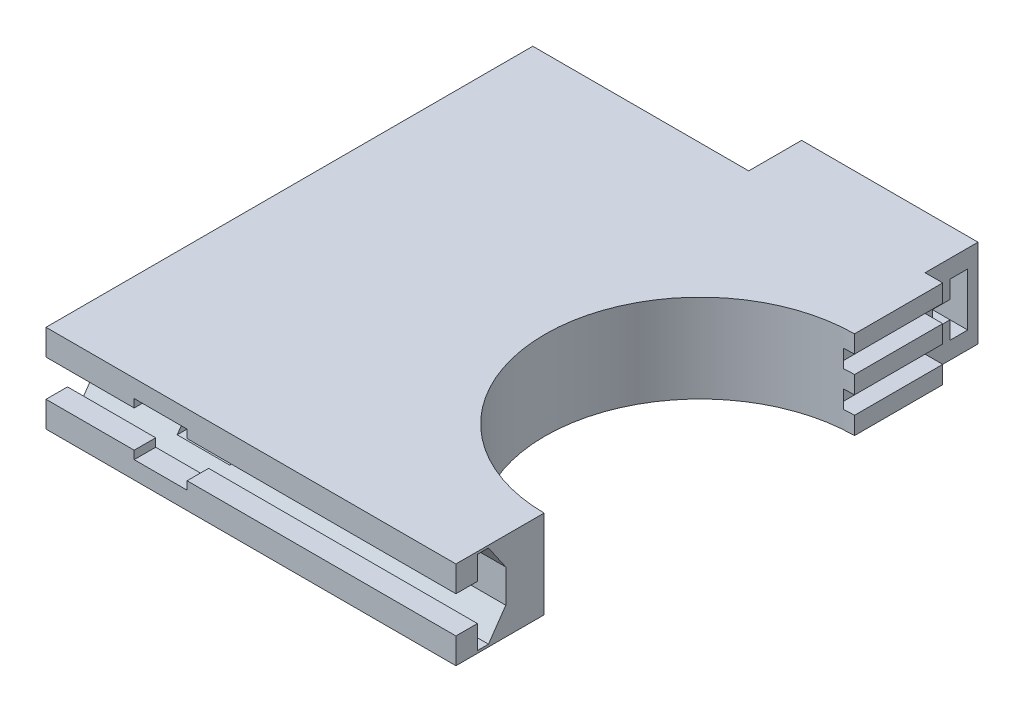
from build123d import *

# Parameters (mm, degrees)
SKETCH1_R               = 35.052
SKETCH1_R_2             = 22.352
BOSS_EXTRUDE2_DEPTH     = 12.7
CUT_EXTRUDE4_DEPTH      = 52.172017822
CUT_EXTRUDE4_DEPTH_BACK = 52.172017822
SKETCH4_W               = 50.006101534
SKETCH4_H               = 77.834708864
BOSS_EXTRUDE6_START     = -12.7
BOSS_EXTRUDE6_DEPTH     = 12.7
CUT_EXTRUDE5_DEPTH      = 93.599518977
CUT_EXTRUDE5_DEPTH_BACK = 93.599518977
SKETCH14_W              = 7.62
SKETCH14_H              = 7.62
CAVITY1_START           = 2.54
CAVITY1_DEPTH           = 2.54
CAVITY1_START_2         = 7.62
CAVITY1_2_DEPTH         = 2.54
SKETCH16_W              = 25.4
SKETCH16_H              = 12.7
BOSS_EXTRUDE8_DEPTH     = 7.62
CAVITY3_START           = -41.188715615
CAVITY3_OUTLINE_W       = 25.4
CAVITY3_OUTLINE_H       = 7.62
CAVITY3_DEPTH           = 2.54
CAVITY3_START_2         = -38.648715615
CAVITY3_2_OUTLINE_W     = 25.4
CAVITY3_2_OUTLINE_H     = 2.54
CAVITY3_2_DEPTH         = 2.54
CUT_EXTRUDE6_DEPTH      = 74.941076403
CUT_EXTRUDE6_DEPTH_BACK = 74.941076403


# Read off the part's stored shape, not the designer's step: Cavity1, Cavity3
with BuildPart() as part:
    # Sketch1 → Boss-Extrude2 (new body)
    with BuildSketch(Plane(origin=(0, 0, 0), x_dir=(1, 0, 0), z_dir=(0, 1, 0))):
        with Locations(Location((0, 0, 0), (0, 0, 270))):
            Circle(SKETCH1_R)
        with Locations(Location((0, 0, 0), (0, 0, 270))):
            Circle(SKETCH1_R_2, mode=Mode.SUBTRACT)
    extrude(amount=BOSS_EXTRUDE2_DEPTH)

    # Sketch4 → Cut-Extrude4 (cut, two sides: drawn at the far end of the back side and taken through both)
    with BuildSketch(Plane(origin=(0, 12.7, 0), x_dir=(1, 0, 0), z_dir=(0, 1, 0)).offset(-CUT_EXTRUDE4_DEPTH_BACK)):
        with Locations((24.88666989, 1.453038664)):
            Rectangle(SKETCH4_W, SKETCH4_H)
    extrude(amount=CUT_EXTRUDE4_DEPTH + CUT_EXTRUDE4_DEPTH_BACK, mode=Mode.SUBTRACT)

    # Sketch13 → Boss-Extrude6 (add)
    with BuildSketch(Plane(origin=(0, 12.7, 0), x_dir=(1, 0, 0), z_dir=(0, 1, 0)).offset(BOSS_EXTRUDE6_START)):
        with BuildLine():
            Line((-22.534267524, 26.848640397), (-22.534267524, 35.051806794))
            Line((-22.534267524, 35.051806794), (-59.151198439, 35.051806794))
            Line((-59.151198439, 35.051806794), (-59.151198439, -35.051806794))
            Line((-59.151198439, -35.051806794), (-22.534267524, -35.051806794))
            Line((-22.534267524, -35.051806794), (-22.534267524, -26.848640397))
            ThreePointArc((-22.534267524, -26.848640397), (-35.052, 0), (-22.534267524, 26.848640397))
        make_face()
        with BuildLine():
            ThreePointArc((-22.534267524, 26.848640397), (-12.045163053, 32.917423214), (-0.116380877, 35.051806794))
            Line((-0.116380877, 35.051806794), (-22.534267524, 35.051806794))
            Line((-22.534267524, 35.051806794), (-22.534267524, 26.848640397))
        make_face()
        with BuildLine():
            Line((-22.534267524, -35.051806794), (-0.116380877, -35.051806794))
            ThreePointArc((-0.116380877, -35.051806794), (-12.045163053, -32.917423214), (-22.534267524, -26.848640397))
            Line((-22.534267524, -26.848640397), (-22.534267524, -35.051806794))
        make_face()
    extrude(amount=BOSS_EXTRUDE6_DEPTH)

    # Sketch14 → Cut-Extrude5 (cut, two sides: drawn at the far end of the back side and taken through both)
    with BuildSketch(Plane.XY.offset(35.051806794).offset(-CUT_EXTRUDE5_DEPTH_BACK)):
        with Locations((-42.641198439, 6.35)):
            Rectangle(SKETCH14_W, SKETCH14_H)
    extrude(amount=CUT_EXTRUDE5_DEPTH + CUT_EXTRUDE5_DEPTH_BACK, mode=Mode.SUBTRACT)

    # Cavity1 outline → Cavity1 (cut)
    with BuildSketch(Plane(origin=(0, 0, 0), x_dir=(1, 0, 0), z_dir=(0, 1, 0)).offset(CAVITY1_START)):
        with BuildLine():
            Line((-2.656380877, 35.051806794), (-2.656380877, 22.289859607))
            Line((-2.656380877, 22.289859607), (-1.66555177, 22.289859607))
            ThreePointArc((-1.66555177, 22.289859607), (-0.891502639, 22.33421427), (-0.116380877, 22.351697016))
            Line((-0.116380877, 22.351697016), (-0.116380877, 35.051806794))
            Line((-0.116380877, 35.051806794), (-2.656380877, 35.051806794))
        make_face()
    extrude(amount=CAVITY1_DEPTH, mode=Mode.SUBTRACT)

    # Cavity1 2 outline → Cavity1 2 (cut)
    with BuildSketch(Plane(origin=(0, 0, 0), x_dir=(1, 0, 0), z_dir=(0, 1, 0)).offset(CAVITY1_START_2)):
        with BuildLine():
            Line((-2.656380877, 35.051806794), (-2.656380877, 22.289859607))
            Line((-2.656380877, 22.289859607), (-1.66555177, 22.289859607))
            ThreePointArc((-1.66555177, 22.289859607), (-0.891502639, 22.33421427), (-0.116380877, 22.351697016))
            Line((-0.116380877, 22.351697016), (-0.116380877, 35.051806794))
            Line((-0.116380877, 35.051806794), (-2.656380877, 35.051806794))
        make_face()
    extrude(amount=CAVITY1_2_DEPTH, mode=Mode.SUBTRACT)

    # Sketch16 → Boss-Extrude8 (add)
    with BuildSketch(Plane(origin=(0, 0, -35.051806794), x_dir=(-1, 0, 0), z_dir=(0, 0, -1))):
        with Locations((15.356380877, 6.35)):
            Rectangle(SKETCH16_W, SKETCH16_H)
    extrude(amount=BOSS_EXTRUDE8_DEPTH)

    # Cavity3 outline → Cavity3 (cut)
    with BuildSketch(Plane.XY.offset(CAVITY3_START)):
        with Locations((-15.356380877, 6.296394857)):
            Rectangle(CAVITY3_OUTLINE_W, CAVITY3_OUTLINE_H)
    extrude(amount=CAVITY3_DEPTH, mode=Mode.SUBTRACT)

    # Cavity3 2 outline → Cavity3 2 (cut)
    with BuildSketch(Plane.XY.offset(CAVITY3_START_2)):
        with Locations((-15.356380877, 6.296394857)):
            Rectangle(CAVITY3_2_OUTLINE_W, CAVITY3_2_OUTLINE_H)
    extrude(amount=CAVITY3_2_DEPTH, mode=Mode.SUBTRACT)

    # Sketch17 → Cut-Extrude6 (cut, two sides: drawn at the far end of the back side and taken through both)
    with BuildSketch(Plane(origin=(-0.116380877, 0, 0), x_dir=(0, 0, -1), z_dir=(1, 0, 0)).offset(-CUT_EXTRUDE6_DEPTH_BACK)):
        Polygon((-35.051806794, 8.979999947), (-31.955539721, 8.979999947), (-31.955539721, 12.349999947), (-30.365539721, 12.349999947), (-27.874781804, 8.734999947), (-27.874781804, 3.964999947), (-30.365539721, 0.349999947), (-31.955539721, 0.349999947), (-31.955539721, 3.719999947), (-35.051806794, 3.719999947), align=None)
    extrude(amount=CUT_EXTRUDE6_DEPTH + CUT_EXTRUDE6_DEPTH_BACK, mode=Mode.SUBTRACT)


solid = part.part
